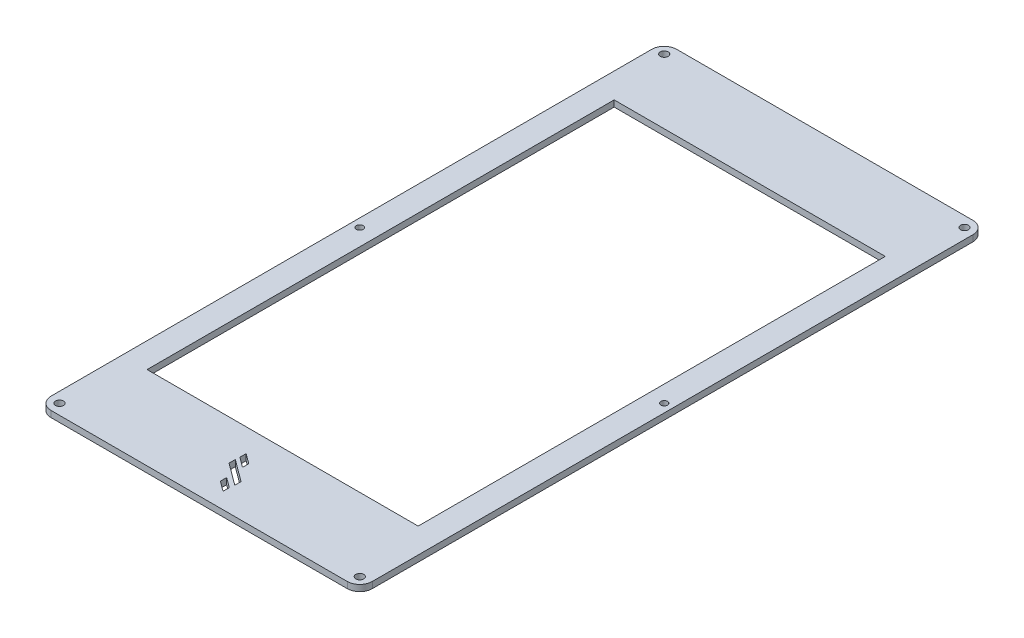
from build123d import *

# Parameters (mm, degrees)
EXTRUDE_1_DEPTH     = 15
FILLET_1_R          = 1
EXTRUDE_START       = -2
SKETCH_2_R          = 1.5
EXTRUDE_2_DEPTH     = 2
FILLET_7_R          = 1
FILLET_2_R          = 1
FILLET_3_R          = 1
FILLET_4_R          = 1
SKETCH_3_R          = 0.95
CUT_EXTRUDE_1_DEPTH = 10
EXTRUDE_3_DEPTH     = 3
FILLET_6_R          = 1
SKETCH_5_R          = 1
CUT_EXTRUDE_2_DEPTH = 2
EXTRUDE_START_2     = 1.5
SKETCH_6_R          = 0.95
EXTRUDE_4_DEPTH     = 1.5
SKETCH_7_W          = 91.570704936
SKETCH_7_H          = 168.371941333
CUT_EXTRUDE_3_DEPTH = 15
SKETCH_8_W          = 65
SKETCH_8_H          = 116
CUT_EXTRUDE_4_DEPTH = 1.5
CUT_EXTRUDE_5_DEPTH = 1.5
SKETCH_10_W         = 65
SKETCH_10_H         = 2
EXTRUDE_5_DEPTH     = 1.5
SKETCH_11_R         = 0.8
CUT_EXTRUDE_6_DEPTH = 1.5


with BuildPart() as part:
    # 草图1 → 凸台-拉伸1 (new body)
    with BuildSketch(Plane(origin=(0.249036734, 0, -75.707167104), x_dir=(1, 0, 0), z_dir=(0, 1, 0))):
        with BuildLine():
            Line((-45.147424513, 1386.006364089), (-45.147424513, 1242.006364089))
            ThreePointArc((-45.147424513, 1242.006364089), (-46.02610417, 1239.885043746), (-48.147424513, 1239.006364089))
            Line((-48.147424513, 1239.006364089), (-119.147424513, 1239.006364089))
            ThreePointArc((-119.147424513, 1239.006364089), (-121.268744857, 1239.885043746), (-122.147424513, 1242.006364089))
            Line((-122.147424513, 1242.006364089), (-122.147424513, 1386.006364089))
            ThreePointArc((-122.147424513, 1386.006364089), (-121.268744857, 1388.127684433), (-119.147424513, 1389.006364089))
            Line((-119.147424513, 1389.006364089), (-48.147424513, 1389.006364089))
            ThreePointArc((-48.147424513, 1389.006364089), (-46.02610417, 1388.127684433), (-45.147424513, 1386.006364089))
        make_face()
        with BuildLine():
            Line((-110.647424513, 1387.506364089), (-86.803457574, 1387.506364089))
            Line((-86.803457574, 1387.506364089), (-86.803457574, 1384.506364089))
            Line((-86.803457574, 1384.506364089), (-79.369983761, 1384.506364089))
            Line((-79.369983761, 1384.506364089), (-79.369983761, 1387.506364089))
            Line((-79.369983761, 1387.506364089), (-56.647424513, 1387.506364089))
            ThreePointArc((-56.647424513, 1387.506364089), (-49.576356701, 1384.577431901), (-46.647424513, 1377.506364089))
            Line((-46.647424513, 1377.506364089), (-46.647424513, 1369.006364089))
            Line((-46.647424513, 1369.006364089), (-49.044172281, 1369.006364089))
            Line((-49.044172281, 1369.006364089), (-49.044172281, 1366.006364089))
            Line((-49.044172281, 1366.006364089), (-46.647424513, 1366.006364089))
            Line((-46.647424513, 1366.006364089), (-46.647424513, 1262.006364089))
            Line((-46.647424513, 1262.006364089), (-49.044172281, 1262.006364089))
            Line((-49.044172281, 1262.006364089), (-49.044172281, 1259.006364089))
            Line((-49.044172281, 1259.006364089), (-46.647424513, 1259.006364089))
            Line((-46.647424513, 1259.006364089), (-46.647424513, 1250.506364089))
            ThreePointArc((-46.647424513, 1250.506364089), (-49.576356701, 1243.435296277), (-56.647424513, 1240.506364089))
            Line((-56.647424513, 1240.506364089), (-80.788236334, 1240.506364089))
            Line((-80.788236334, 1240.506364089), (-80.788236334, 1243.506364089))
            Line((-80.788236334, 1243.506364089), (-86.803457574, 1243.506364089))
            Line((-86.803457574, 1243.506364089), (-86.803457574, 1240.506364089))
            Line((-86.803457574, 1240.506364089), (-110.647424513, 1240.506364089))
            ThreePointArc((-110.647424513, 1240.506364089), (-117.718492325, 1243.435296277), (-120.647424513, 1250.506364089))
            Line((-120.647424513, 1250.506364089), (-120.647424513, 1259.006364089))
            Line((-120.647424513, 1259.006364089), (-118.250676745, 1259.006364089))
            Line((-118.250676745, 1259.006364089), (-118.250676745, 1262.006364089))
            Line((-118.250676745, 1262.006364089), (-120.647424513, 1262.006364089))
            Line((-120.647424513, 1262.006364089), (-120.647424513, 1366.006364089))
            Line((-120.647424513, 1366.006364089), (-118.250676745, 1366.006364089))
            Line((-118.250676745, 1366.006364089), (-118.250676745, 1369.006364089))
            Line((-118.250676745, 1369.006364089), (-120.647424513, 1369.006364089))
            Line((-120.647424513, 1369.006364089), (-120.647424513, 1377.506364089))
            ThreePointArc((-120.647424513, 1377.506364089), (-117.718492325, 1384.577431901), (-110.647424513, 1387.506364089))
        make_face(mode=Mode.SUBTRACT)
    extrude(amount=EXTRUDE_1_DEPTH)

    # 圆角1
    fillet_1_edges = [part.edges().sort_by_distance(p)[0] for p in [
        (-48.795135547, 7.5, -1334.713531194),
        (-48.795135547, 7.5, -1337.713531194),
        (-48.795135547, 7.5, -1441.713531194),
        (-48.795135547, 7.5, -1444.713531194),
        (-79.120947027, 7.5, -1460.213531194),
        (-86.55442084, 7.5, -1460.213531194),
        (-118.001640012, 7.5, -1444.713531194),
        (-118.001640012, 7.5, -1441.713531194),
        (-118.001640012, 7.5, -1337.713531194),
        (-118.001640012, 7.5, -1334.713531194),
        (-86.55442084, 7.5, -1319.213531194),
        (-80.5391996, 7.5, -1319.213531194),
    ]]
    fillet(fillet_1_edges, radius=FILLET_1_R)

    # 草图2 → 凸台-拉伸2 (add)
    with BuildSketch(Plane(origin=(0.249036734, 15, -75.707167104), x_dir=(1, 0, 0), z_dir=(0, 1, 0)).offset(EXTRUDE_START)):
        with BuildLine():
            Line((-45.147424513, 1242.006364089), (-45.147424513, 1386.006364089))
            ThreePointArc((-45.147424513, 1386.006364089), (-46.02610417, 1388.127684433), (-48.147424513, 1389.006364089))
            Line((-48.147424513, 1389.006364089), (-119.147424513, 1389.006364089))
            ThreePointArc((-119.147424513, 1389.006364089), (-121.268744857, 1388.127684433), (-122.147424513, 1386.006364089))
            Line((-122.147424513, 1386.006364089), (-122.147424513, 1242.006364089))
            ThreePointArc((-122.147424513, 1242.006364089), (-121.268744857, 1239.885043746), (-119.147424513, 1239.006364089))
            Line((-119.147424513, 1239.006364089), (-48.147424513, 1239.006364089))
            ThreePointArc((-48.147424513, 1239.006364089), (-46.02610417, 1239.885043746), (-45.147424513, 1242.006364089))
        make_face()
        with Locations(Location((-84.647424513, 1378.506364089, 0), (0, 0, 270))):
            Circle(SKETCH_2_R, mode=Mode.SUBTRACT)
        with Locations(Location((-84.647424513, 1328.506364089, 0), (0, 0, 270))):
            Circle(SKETCH_2_R, mode=Mode.SUBTRACT)
        with BuildLine():
            Line((-65.147424513, 1308.756575121), (-65.147424513, 1318.506364089))
            ThreePointArc((-65.147424513, 1318.506364089), (-65.440317732, 1319.21347087), (-66.147424513, 1319.506364089))
            Line((-66.147424513, 1319.506364089), (-92.147424513, 1319.506364089))
            ThreePointArc((-92.147424513, 1319.506364089), (-92.854531294, 1319.21347087), (-93.147424513, 1318.506364089))
            Line((-93.147424513, 1318.506364089), (-93.147424513, 1313.006364089))
            ThreePointArc((-93.147424513, 1313.006364089), (-93.440317732, 1312.299257308), (-94.147424513, 1312.006364089))
            Line((-94.147424513, 1312.006364089), (-95.147424513, 1312.006364089))
            ThreePointArc((-95.147424513, 1312.006364089), (-95.854531294, 1311.71347087), (-96.147424513, 1311.006364089))
            Line((-96.147424513, 1311.006364089), (-96.147424513, 1305.006364089))
            ThreePointArc((-96.147424513, 1305.006364089), (-95.854531294, 1304.299257308), (-95.147424513, 1304.006364089))
            Line((-95.147424513, 1304.006364089), (-86.147424513, 1304.006364089))
            ThreePointArc((-86.147424513, 1304.006364089), (-85.440317732, 1303.71347087), (-85.147424513, 1303.006364089))
            Line((-85.147424513, 1303.006364089), (-85.147424513, 1274.006364089))
            ThreePointArc((-85.147424513, 1274.006364089), (-84.854531294, 1273.299257308), (-84.147424513, 1273.006364089))
            Line((-84.147424513, 1273.006364089), (-65.147424513, 1273.006364089))
            Line((-65.147424513, 1273.006364089), (-64.147424513, 1273.006364089))
            Line((-64.147424513, 1273.006364089), (-64.147424513, 1269.756575121))
            ThreePointArc((-64.147424513, 1269.756575121), (-63.854531294, 1269.04946834), (-63.147424513, 1268.756575121))
            Line((-63.147424513, 1268.756575121), (-56.817685319, 1268.756575121))
            ThreePointArc((-56.817685319, 1268.756575121), (-56.110578538, 1269.04946834), (-55.817685319, 1269.756575121))
            Line((-55.817685319, 1269.756575121), (-55.817685319, 1308.756575121))
            Line((-55.817685319, 1308.756575121), (-65.147424513, 1308.756575121))
        make_face(mode=Mode.SUBTRACT)
        with BuildLine():
            Line((-89.147424513, 1277.506364089), (-99.147424513, 1277.506364089))
            ThreePointArc((-99.147424513, 1277.506364089), (-99.854531294, 1277.799257308), (-100.147424513, 1278.506364089))
            Line((-100.147424513, 1278.506364089), (-100.147424513, 1283.506364089))
            ThreePointArc((-100.147424513, 1283.506364089), (-99.854531294, 1284.21347087), (-99.147424513, 1284.506364089))
            Line((-99.147424513, 1284.506364089), (-89.147424513, 1284.506364089))
            ThreePointArc((-89.147424513, 1284.506364089), (-88.440317732, 1284.21347087), (-88.147424513, 1283.506364089))
            Line((-88.147424513, 1283.506364089), (-88.147424513, 1278.506364089))
            ThreePointArc((-88.147424513, 1278.506364089), (-88.440317732, 1277.799257308), (-89.147424513, 1277.506364089))
        make_face(mode=Mode.SUBTRACT)
        with BuildLine():
            Line((-104.147424513, 1374.006364089), (-65.147424513, 1374.006364089))
            ThreePointArc((-65.147424513, 1374.006364089), (-64.440317732, 1373.71347087), (-64.147424513, 1373.006364089))
            Line((-64.147424513, 1373.006364089), (-64.147424513, 1334.006364089))
            ThreePointArc((-64.147424513, 1334.006364089), (-64.440317732, 1333.299257308), (-65.147424513, 1333.006364089))
            Line((-65.147424513, 1333.006364089), (-104.147424513, 1333.006364089))
            ThreePointArc((-104.147424513, 1333.006364089), (-104.854531294, 1333.299257308), (-105.147424513, 1334.006364089))
            Line((-105.147424513, 1334.006364089), (-105.147424513, 1373.006364089))
            ThreePointArc((-105.147424513, 1373.006364089), (-104.854531294, 1373.71347087), (-104.147424513, 1374.006364089))
        make_face(mode=Mode.SUBTRACT)
    extrude(amount=EXTRUDE_2_DEPTH)

    # 圆角7
    fillet_7_edges = [part.edges().sort_by_distance(p)[0] for p in [
        (-63.898387779, 14, -1348.713531194),
        (-64.898387779, 14, -1384.463742225),
        (-55.568648585, 14, -1384.463742225),
    ]]
    fillet(fillet_7_edges, radius=FILLET_7_R)

    # 圆角2
    fillet_2_edges = [part.edges().sort_by_distance(p)[0] for p in [
        (-78.898387779, 15, -1395.213531194),
        (-92.60549456, 15, -1394.920637975),
        (-92.898387779, 15, -1391.463531194),
        (-93.191280998, 15, -1388.006424412),
        (-94.398387779, 15, -1387.713531194),
        (-95.60549456, 15, -1387.420637975),
        (-95.898387779, 15, -1383.713531194),
        (-95.60549456, 15, -1380.006424412),
        (-90.398387779, 15, -1379.713531194),
        (-85.191280998, 15, -1379.420637975),
        (-84.898387779, 15, -1364.213531194),
        (-84.60549456, 15, -1349.006424412),
        (-74.398387779, 15, -1348.713531194),
        (-64.898387779, 15, -1389.838636709),
        (-65.191280998, 15, -1394.920637975),
        (-93.898387779, 15, -1360.213531194),
        (-99.60549456, 15, -1359.920637975),
        (-99.898387779, 15, -1356.713531194),
        (-99.60549456, 15, -1353.506424412),
        (-93.898387779, 15, -1353.213531194),
        (-88.191280998, 15, -1353.506424412),
        (-87.898387779, 15, -1356.713531194),
        (-88.191280998, 15, -1359.920637975),
        (-83.398387779, 15, -1314.713531194),
        (-121.019708123, 15, -1315.59221085),
        (-121.898387779, 15, -1389.713531194),
        (-121.019708123, 15, -1463.834851537),
        (-83.398387779, 15, -1464.713531194),
        (-45.777067436, 15, -1463.834851537),
        (-44.898387779, 15, -1389.713531194),
        (-45.777067436, 15, -1315.59221085),
        (-63.898387779, 15, -1429.213531194),
        (-64.191280998, 15, -1449.420637975),
        (-84.398387779, 15, -1449.713531194),
        (-104.60549456, 15, -1449.420637975),
        (-104.898387779, 15, -1429.213531194),
        (-104.60549456, 15, -1409.006424412),
        (-84.398387779, 15, -1408.713531194),
        (-64.191280998, 15, -1409.006424412),
        (-84.398387779, 15, -1455.713531194),
        (-84.398387779, 15, -1405.713531194),
        (-59.733518182, 15, -1344.463742225),
        (-55.861541804, 15, -1344.756635444),
        (-55.568648585, 15, -1364.463742225),
        (-60.233518182, 15, -1384.463742225),
        (-63.898387779, 15, -1346.588636709),
        (-63.60549456, 15, -1344.756635444),
        (-55.861541804, 15, -1384.170849006),
        (-64.60549456, 15, -1384.756635444),
        (-64.191280998, 15, -1348.420637975),
    ]]
    fillet(fillet_2_edges, radius=FILLET_2_R)

    # 圆角3
    fillet_3_edges = [part.edges().sort_by_distance(p)[0] for p in [
        (-48.795135547, 0, -1336.213531194),
        (-47.096761663, 0, -1337.713531194),
        (-48.795135547, 0, -1443.213531194),
        (-47.096761663, 0, -1444.713531194),
        (-82.837683934, 0, -1460.213531194),
        (-86.55442084, 0, -1462.213531194),
        (-118.001640012, 0, -1443.213531194),
        (-119.700013895, 0, -1441.713531194),
        (-118.001640012, 0, -1336.213531194),
        (-119.700013895, 0, -1334.713531194),
        (-118.29453323, 0, -1444.420637975),
        (-118.29453323, 0, -1442.006424412),
        (-48.502242328, 0, -1444.420637975),
        (-48.502242328, 0, -1442.006424412),
        (-48.502242328, 0, -1337.420637975),
        (-48.502242328, 0, -1335.006424412),
        (-118.29453323, 0, -1337.420637975),
        (-118.29453323, 0, -1335.006424412),
        (-86.261527622, 0, -1460.506424412),
        (-79.413840246, 0, -1460.506424412),
        (-47.096761663, 0, -1334.713531194),
        (-47.096761663, 0, -1441.713531194),
        (-79.120947027, 0, -1462.213531194),
        (-119.700013895, 0, -1444.713531194),
        (-119.700013895, 0, -1337.713531194),
    ]]
    fillet(fillet_3_edges, radius=FILLET_3_R)

    # 圆角4
    fillet_4_edges = [part.edges().sort_by_distance(p)[0] for p in [
        (-74.398387779, 13, -1348.713531194),
        (-84.60549456, 13, -1349.006424412),
        (-84.898387779, 13, -1364.213531194),
        (-85.191280998, 13, -1379.420637975),
        (-90.398387779, 13, -1379.713531194),
        (-95.60549456, 13, -1380.006424412),
        (-95.898387779, 13, -1383.713531194),
        (-95.60549456, 13, -1387.420637975),
        (-94.398387779, 13, -1387.713531194),
        (-93.191280998, 13, -1388.006424412),
        (-92.898387779, 13, -1391.463531194),
        (-92.60549456, 13, -1394.920637975),
        (-78.898387779, 13, -1395.213531194),
        (-65.191280998, 13, -1394.920637975),
        (-64.898387779, 13, -1389.838636709),
        (-88.191280998, 13, -1353.506424412),
        (-93.898387779, 13, -1353.213531194),
        (-99.60549456, 13, -1353.506424412),
        (-99.898387779, 13, -1356.713531194),
        (-99.60549456, 13, -1359.920637975),
        (-93.898387779, 13, -1360.213531194),
        (-88.191280998, 13, -1359.920637975),
        (-87.898387779, 13, -1356.713531194),
        (-86.261527622, 13, -1318.920637975),
        (-83.54681022, 13, -1319.213531194),
        (-80.832092819, 13, -1318.920637975),
        (-80.5391996, 13, -1317.213531194),
        (-68.46879369, 13, -1316.213531194),
        (-49.327319967, 13, -1319.142463382),
        (-46.398387779, 13, -1330.463531194),
        (-47.096761663, 13, -1334.713531194),
        (-48.502242328, 13, -1335.006424412),
        (-48.795135547, 13, -1336.213531194),
        (-48.502242328, 13, -1337.420637975),
        (-47.096761663, 13, -1337.713531194),
        (-46.398387779, 13, -1389.713531194),
        (-47.096761663, 13, -1441.713531194),
        (-48.502242328, 13, -1442.006424412),
        (-48.795135547, 13, -1443.213531194),
        (-48.502242328, 13, -1444.420637975),
        (-47.096761663, 13, -1444.713531194),
        (-46.398387779, 13, -1448.963531194),
        (-49.327319967, 13, -1460.284599005),
        (-67.759667403, 13, -1463.213531194),
        (-79.120947027, 13, -1462.213531194),
        (-79.413840246, 13, -1460.506424412),
        (-82.837683934, 13, -1460.213531194),
        (-86.261527622, 13, -1460.506424412),
        (-86.55442084, 13, -1462.213531194),
        (-98.47640431, 13, -1463.213531194),
        (-117.469455591, 13, -1460.284599005),
        (-120.398387779, 13, -1448.963531194),
        (-119.700013895, 13, -1444.713531194),
        (-118.29453323, 13, -1444.420637975),
        (-118.001640012, 13, -1443.213531194),
        (-118.29453323, 13, -1442.006424412),
        (-119.700013895, 13, -1441.713531194),
        (-120.398387779, 13, -1389.713531194),
        (-119.700013895, 13, -1337.713531194),
        (-118.29453323, 13, -1337.420637975),
        (-118.001640012, 13, -1336.213531194),
        (-118.29453323, 13, -1335.006424412),
        (-119.700013895, 13, -1334.713531194),
        (-120.398387779, 13, -1330.463531194),
        (-117.469455591, 13, -1319.142463382),
        (-98.47640431, 13, -1316.213531194),
        (-86.55442084, 13, -1317.213531194),
        (-104.60549456, 13, -1409.006424412),
        (-104.898387779, 13, -1429.213531194),
        (-104.60549456, 13, -1449.420637975),
        (-84.398387779, 13, -1449.713531194),
        (-64.191280998, 13, -1449.420637975),
        (-63.898387779, 13, -1429.213531194),
        (-64.191280998, 13, -1409.006424412),
        (-84.398387779, 13, -1408.713531194),
        (-84.398387779, 13, -1455.713531194),
        (-84.398387779, 13, -1405.713531194),
        (-60.233518182, 13, -1384.463742225),
        (-55.568648585, 13, -1364.463742225),
        (-55.861541804, 13, -1344.756635444),
        (-59.733518182, 13, -1344.463742225),
        (-63.60549456, 13, -1344.756635444),
        (-63.898387779, 13, -1346.588636709),
        (-64.60549456, 13, -1384.756635444),
        (-55.861541804, 13, -1384.170849006),
        (-64.191280998, 13, -1348.420637975),
    ]]
    fillet(fillet_4_edges, radius=FILLET_4_R - 0.0001)  # a hair under: the kernel refuses the full size

    # 草图3 → 切除-拉伸1 (cut)
    with BuildSketch(Plane(origin=(0.249036734, 0, -75.707167104), x_dir=(1, 0, 0), z_dir=(0, -1, 0))):
        with Locations(Location((-47.647424513, -1241.506364089, 0), (0, 0, 270))):
            Circle(SKETCH_3_R)
        with Locations(Location((-47.647424513, -1386.506364089, 0), (0, 0, 90))):
            Circle(SKETCH_3_R)
        with Locations(Location((-119.647424513, -1386.506364089, 0), (0, 0, 270))):
            Circle(SKETCH_3_R)
        with Locations(Location((-119.647424513, -1241.506364089, 0), (0, 0, 90))):
            Circle(SKETCH_3_R)
    extrude(amount=-CUT_EXTRUDE_1_DEPTH, mode=Mode.SUBTRACT)

    # 草图4 → 凸台-拉伸3 (add)
    with BuildSketch(Plane(origin=(0.249036734, 13, -75.707167104), x_dir=(1, 0, 0), z_dir=(0, -1, 0))):
        with BuildLine():
            Line((-92.147424513, -1320.506364089), (-66.038217179, -1320.506364089))
            Line((-66.038217179, -1320.506364089), (-66.038217179, -1323.506364089))
            ThreePointArc((-66.038217179, -1323.506364089), (-66.331110398, -1324.21347087), (-67.038217179, -1324.506364089))
            Line((-67.038217179, -1324.506364089), (-91.147424513, -1324.506364089))
            ThreePointArc((-91.147424513, -1324.506364089), (-91.854531294, -1324.21347087), (-92.147424513, -1323.506364089))
            Line((-92.147424513, -1323.506364089), (-92.147424513, -1320.506364089))
        make_face()
    extrude(amount=EXTRUDE_3_DEPTH)

    # 圆角6
    fillet_6_edges = [part.edges().sort_by_distance(p)[0] for p in [
        (-91.898387779, 10, -1397.713531194),
        (-91.60549456, 10, -1399.920637975),
        (-78.843784112, 10, -1400.213531194),
        (-66.082073664, 10, -1399.920637975),
        (-65.789180445, 10, -1397.713531194),
        (-78.843784112, 10, -1396.213531194),
    ]]
    fillet(fillet_6_edges, radius=FILLET_6_R)

    # 草图5 → 切除-拉伸2 (cut)
    with BuildSketch(Plane(origin=(0.249036734, 15, -75.707167104), x_dir=(1, 0, 0), z_dir=(0, 1, 0))):
        with Locations(Location((-58.147424513, 1320.006364089, 0), (0, 0, 270))):
            Circle(SKETCH_5_R)
        with Locations(Location((-53.147424513, 1307.506364089, 0), (0, 0, 270))):
            Circle(SKETCH_5_R)
        with Locations(Location((-53.147424513, 1332.506364089, 0), (0, 0, 270))):
            Circle(SKETCH_5_R)
        with Locations(Location((-114.147424513, 1332.506364089, 0), (0, 0, 270))):
            Circle(SKETCH_5_R)
        with Locations(Location((-114.147424513, 1307.506364089, 0), (0, 0, 270))):
            Circle(SKETCH_5_R)
        with Locations(Location((-109.147424513, 1320.006364089, 0), (0, 0, 270))):
            Circle(SKETCH_5_R)
    extrude(amount=-CUT_EXTRUDE_2_DEPTH, mode=Mode.SUBTRACT)

    # 草图6 → 凸台-拉伸4 (add)
    with BuildSketch(Plane.XZ.offset(EXTRUDE_START_2)):
        with BuildLine():
            Line((-47.898387779, -1314.713531194), (-118.898387779, -1314.713531194))
            ThreePointArc((-118.898387779, -1314.713531194), (-121.019708123, -1315.59221085), (-121.898387779, -1317.713531194))
            Line((-121.898387779, -1317.713531194), (-121.898387779, -1461.713531194))
            ThreePointArc((-121.898387779, -1461.713531194), (-121.019708123, -1463.834851537), (-118.898387779, -1464.713531194))
            Line((-118.898387779, -1464.713531194), (-47.898387779, -1464.713531194))
            ThreePointArc((-47.898387779, -1464.713531194), (-45.777067436, -1463.834851537), (-44.898387779, -1461.713531194))
            Line((-44.898387779, -1461.713531194), (-44.898387779, -1317.713531194))
            ThreePointArc((-44.898387779, -1317.713531194), (-45.777067436, -1315.59221085), (-47.898387779, -1314.713531194))
        make_face()
        with Locations(Location((-119.398387779, -1462.213531194, 0), (0, 0, 270))):
            Circle(SKETCH_6_R, mode=Mode.SUBTRACT)
        with Locations(Location((-119.398387779, -1317.213531194, 0), (0, 0, 270))):
            Circle(SKETCH_6_R, mode=Mode.SUBTRACT)
        with Locations(Location((-47.398387779, -1462.213531194, 0), (0, 0, 270))):
            Circle(SKETCH_6_R, mode=Mode.SUBTRACT)
        with Locations(Location((-47.398387779, -1317.213531194, 0), (0, 0, 270))):
            Circle(SKETCH_6_R, mode=Mode.SUBTRACT)
    extrude(amount=-EXTRUDE_4_DEPTH)

    # 草图7 → 切除-拉伸3 (cut)
    with BuildSketch(Plane(origin=(0, 15, 0), x_dir=(1, 0, 0), z_dir=(0, 1, 0))):
        with Locations((-86.571088428, 1387.361356575)):
            Rectangle(SKETCH_7_W, SKETCH_7_H)
    extrude(amount=-CUT_EXTRUDE_3_DEPTH, mode=Mode.SUBTRACT)

    # 草图8 → 切除-拉伸4 (cut)
    with BuildSketch(Plane.XZ.offset(1.5)):
        with Locations((-83.398387779, -1390.713531194)):
            Rectangle(SKETCH_8_W, SKETCH_8_H)
    extrude(amount=-CUT_EXTRUDE_4_DEPTH, mode=Mode.SUBTRACT)

    # 草图9 → 切除-拉伸5 (cut)
    with BuildSketch(Plane.XZ.offset(1.5)):
        Polygon((-81.363761094, -1321.208175621), (-81.363761094, -1322.709507196), (-86.637910806, -1326.609548937), (-86.637910806, -1325.108217362), align=None)
        Polygon((-81.52044595, -1318.547509884), (-81.52044595, -1320.048841458), (-83.937884263, -1321.836449099), (-83.937884263, -1320.335117525), align=None)
        Polygon((-84.153251374, -1325.852632827), (-84.153251374, -1327.353964401), (-86.570689687, -1329.141572042), (-86.570689687, -1327.640240468), align=None)
    extrude(amount=-CUT_EXTRUDE_5_DEPTH, mode=Mode.SUBTRACT)

    # 草图10 → 凸台-拉伸5 (add)
    with BuildSketch(Plane.XZ.offset(1.5)):
        with Locations((-83.398387779, -1333.713531194)):
            Rectangle(SKETCH_10_W, SKETCH_10_H)
        with Locations((-83.398387779, -1447.713531194)):
            Rectangle(SKETCH_10_W, SKETCH_10_H)
    extrude(amount=-EXTRUDE_5_DEPTH)

    # 草图11 → 切除-拉伸6 (cut)
    with BuildSketch(Plane.XZ.offset(1.5)):
        with Locations(Location((-46.898387779, -1389.713531194, 0), (0, 0, 270))):
            Circle(SKETCH_11_R)
        with Locations(Location((-119.898387779, -1389.713531194, 0), (0, 0, 270))):
            Circle(SKETCH_11_R)
    extrude(amount=-CUT_EXTRUDE_6_DEPTH, mode=Mode.SUBTRACT)


solid = part.part
